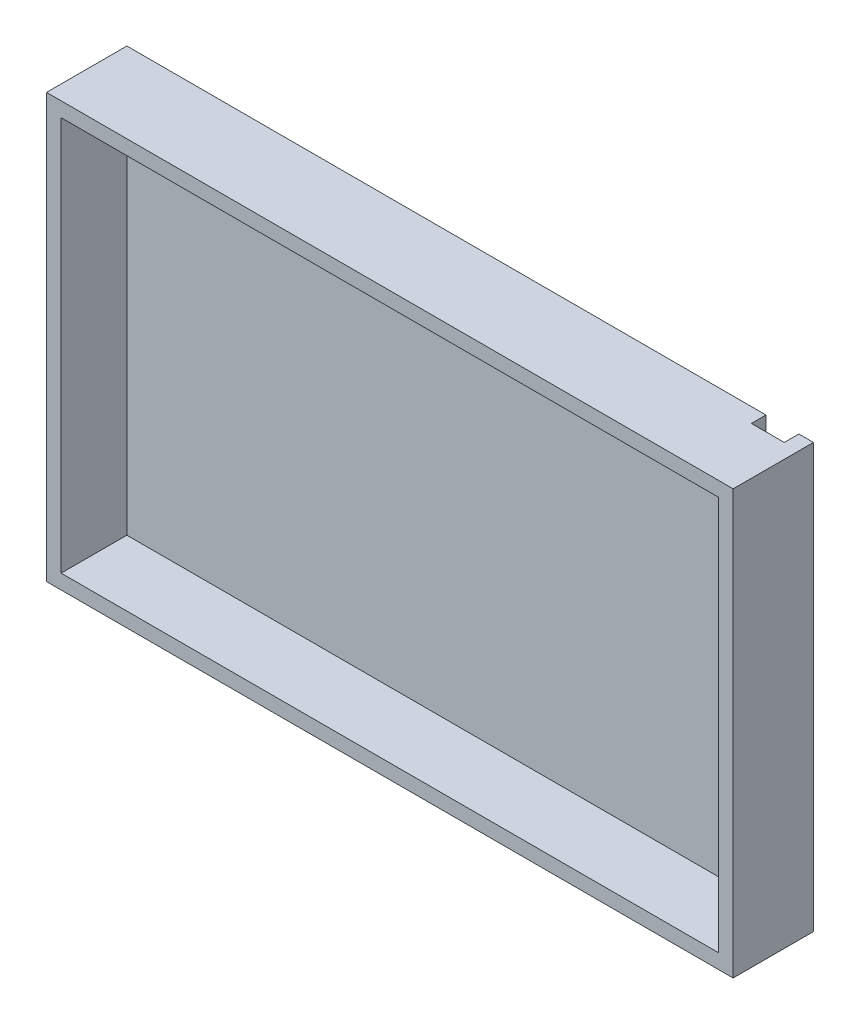
from build123d import *

# Parameters (mm, degrees)
SKETCH2_W           = 94
SKETCH2_H           = 58
BOSS_EXTRUDE1_DEPTH = 11
SKETCH3_W           = 90
SKETCH3_H           = 54
CUT_EXTRUDE1_DEPTH  = 9
SKETCH5_W           = 4.5
SKETCH5_H           = 58
CUT_EXTRUDE2_DEPTH  = 2


with BuildPart() as part:
    # Sketch2 → Boss-Extrude1 (new body)
    with BuildSketch(Plane.XY):
        Rectangle(SKETCH2_W, SKETCH2_H)
    extrude(amount=BOSS_EXTRUDE1_DEPTH)

    # Sketch3 → Cut-Extrude1 (cut)
    with BuildSketch(Plane.XY.offset(11)):
        Rectangle(SKETCH3_W, SKETCH3_H)
    extrude(amount=-CUT_EXTRUDE1_DEPTH, mode=Mode.SUBTRACT)

    # Sketch5 → Cut-Extrude2 (cut)
    with BuildSketch(Plane(origin=(0, 0, 0), x_dir=(-1, 0, 0), z_dir=(0, 0, -1))):
        with Locations((-42.75, 0)):
            Rectangle(SKETCH5_W, SKETCH5_H)
    extrude(amount=-CUT_EXTRUDE2_DEPTH, mode=Mode.SUBTRACT)


solid = part.part
